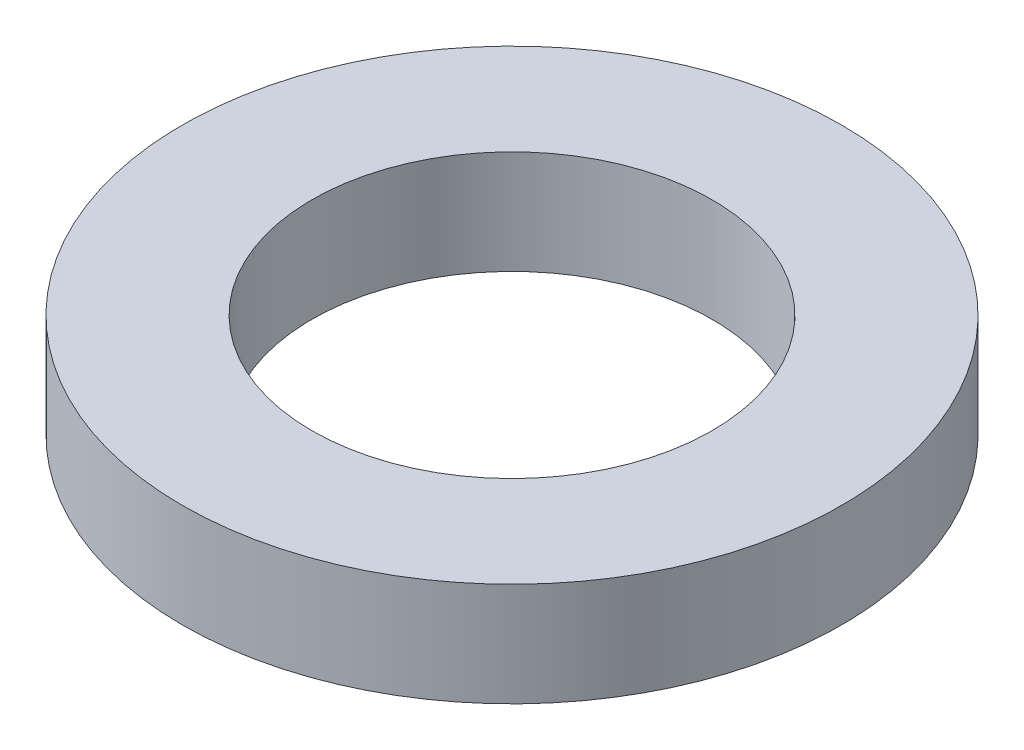
from build123d import *

# Parameters (mm, degrees)
SKETCH1_R           = 70
BOSS_EXTRUDE1_DEPTH = 22
SKETCH2_R           = 42.5
CUT_EXTRUDE1_DEPTH  = 102.410058673


with BuildPart() as part:
    # Sketch1 → Boss-Extrude1 (new body)
    with BuildSketch(Plane(origin=(0, 0, 0), x_dir=(1, 0, 0), z_dir=(0, 1, 0))):
        Circle(SKETCH1_R)
    extrude(amount=BOSS_EXTRUDE1_DEPTH)

    # Sketch2 → Cut-Extrude1 (cut, through all)
    with BuildSketch(Plane(origin=(0, 0, 0), x_dir=(1, 0, 0), z_dir=(0, 1, 0))):
        Circle(SKETCH2_R)
    extrude(amount=CUT_EXTRUDE1_DEPTH, mode=Mode.SUBTRACT)


solid = part.part
